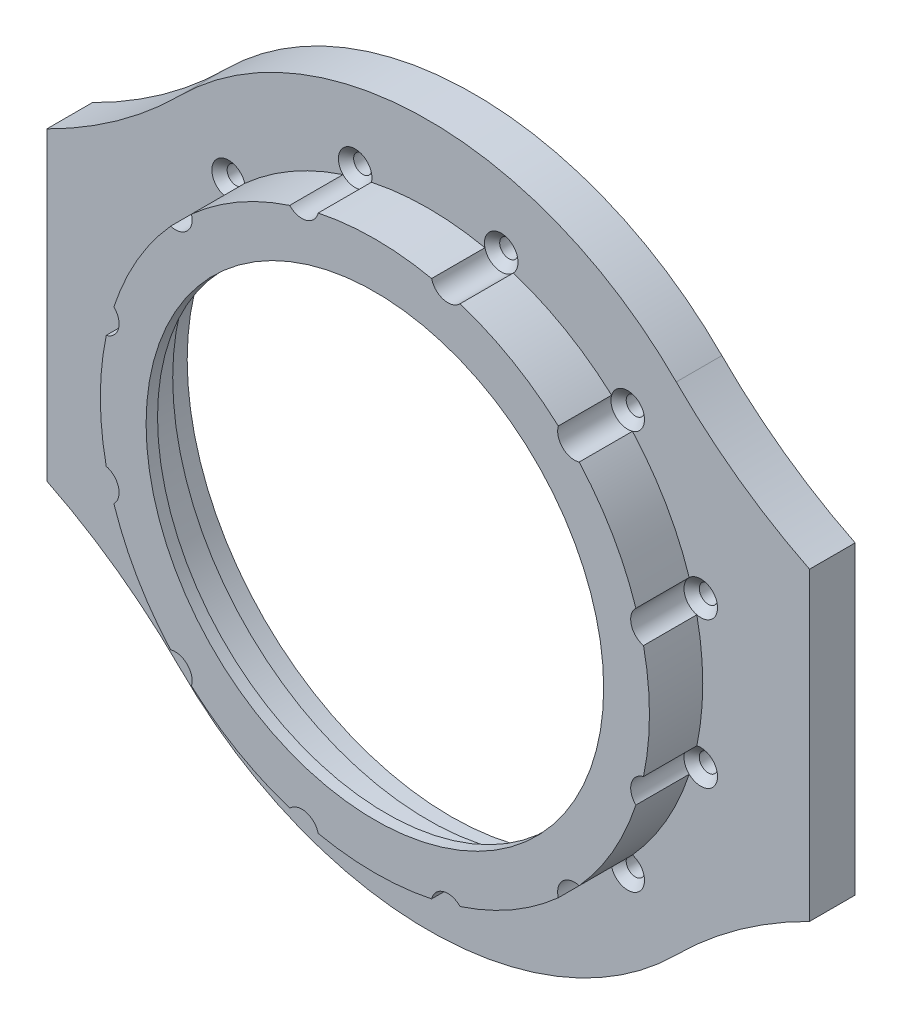
from build123d import *

# Parameters (mm, degrees)
SKETCH_3_R                   = 46
SKETCH_3_R_2                 = 34.6
EXTRUDE_2_DEPTH              = 3
SKETCH_5_R                   = 36
SKETCH_5_R_2                 = 33.5
EXTRUDE_3_DEPTH              = 5.49
EXTRUDE_START                = -2.98
SKETCH_2_R                   = 46
SKETCH_2_R_2                 = 41.6
EXTRUDE_1_DEPTH              = 2.98
SKETCH_6_R                   = 36
SKETCH_6_R_2                 = 30
EXTRUDE_4_DEPTH              = 1.5
EXTRUDE_5_DEPTH              = 3
EXTRUDE_5_DEPTH_BACK         = 2.98
HOLE_WIZARD_M2_1_AT_2_COUNT  = 2
HOLE_WIZARD_M2_1_AT_2_PITCH  = 64.085879878
HOLE_WIZARD_M2_1_AT_3_COUNT  = 2
HOLE_WIZARD_M2_1_AT_3_PITCH  = 71.478511138
HOLE_WIZARD_M2_1_AT_4_COUNT  = 2
HOLE_WIZARD_M2_1_AT_4_PITCH  = 73.999999995
HOLE_WIZARD_M2_1_AT_5_COUNT  = 2
HOLE_WIZARD_M2_1_AT_5_PITCH  = 19.15260934
HOLE_WIZARD_M2_1_AT_6_COUNT  = 2
HOLE_WIZARD_M2_1_AT_6_PITCH  = 36.999999998
HOLE_WIZARD_M2_1_AT_7_COUNT  = 2
HOLE_WIZARD_M2_1_AT_7_PITCH  = 52.325901805
HOLE_WIZARD_M2_1_AT_8_COUNT  = 2
HOLE_WIZARD_M2_1_AT_8_PITCH  = 71.47851114
HOLE_WIZARD_M2_1_AT_9_COUNT  = 2
HOLE_WIZARD_M2_1_AT_9_PITCH  = 64.085879872
HOLE_WIZARD_M2_1_AT_10_COUNT = 2
HOLE_WIZARD_M2_1_AT_10_PITCH = 52.325901805
HOLE_WIZARD_M2_1_AT_11_COUNT = 2
HOLE_WIZARD_M2_1_AT_11_PITCH = 36.999999994
HOLE_WIZARD_M2_1_AT_12_COUNT = 2
HOLE_WIZARD_M2_1_AT_12_PITCH = 19.152609334
CUT_EXTRUDE_1_REACH          = 70.3
SKETCH_13_R                  = 2.2


with BuildPart() as part:
    # 草图3 → 凸台-拉伸2 (new body)
    with BuildSketch(Plane.XY):
        Circle(SKETCH_3_R)
        Circle(SKETCH_3_R_2, mode=Mode.SUBTRACT)
    extrude(amount=EXTRUDE_2_DEPTH)

    # 草图5 → 凸台-拉伸3 (add)
    with BuildSketch(Plane.XY.offset(3)):
        Circle(SKETCH_5_R)
        Circle(SKETCH_5_R_2, mode=Mode.SUBTRACT)
    extrude(amount=EXTRUDE_3_DEPTH)

    # 草图2 → 凸台-拉伸1 (add)
    with BuildSketch(Plane.XY.offset(EXTRUDE_START)):
        Circle(SKETCH_2_R)
        Circle(SKETCH_2_R_2, mode=Mode.SUBTRACT)
    extrude(amount=EXTRUDE_1_DEPTH)

    # 草图6 → 凸台-拉伸4 (add)
    with BuildSketch(Plane.XY.offset(8.49)):
        Circle(SKETCH_6_R)
        Circle(SKETCH_6_R_2, mode=Mode.SUBTRACT)
    extrude(amount=EXTRUDE_4_DEPTH)

    # 草图8 → 凸台-拉伸5 (add, two sides: drawn at the far end of the back side and taken through both)
    with BuildSketch(Plane.XY.offset(-EXTRUDE_5_DEPTH_BACK)):
        with BuildLine():
            Line((-50, -20), (-50, 20))
            ThreePointArc((-50, 20), (-40.750582015, 25.548076808), (-32.526911935, 32.526911935))
            ThreePointArc((-32.526911935, 32.526911935), (-46, 0), (-32.526911935, -32.526911935))
            ThreePointArc((-32.526911935, -32.526911935), (-40.750582015, -25.548076808), (-50, -20))
        make_face()
        with BuildLine():
            Line((50, -20), (50, 20))
            ThreePointArc((50, 20), (40.750582015, 25.548076808), (32.526911935, 32.526911935))
            ThreePointArc((32.526911935, 32.526911935), (46, 0), (32.526911935, -32.526911935))
            ThreePointArc((32.526911935, -32.526911935), (40.750582015, -25.548076808), (50, -20))
        make_face()
    extrude(amount=EXTRUDE_5_DEPTH + EXTRUDE_5_DEPTH_BACK)

    # 草图12 → M2 锥坑平头的锥孔1 (revolve, cut)
    with BuildSketch(Plane(origin=(-35.73925557, -9.57630467, 3), x_dir=(0, -1, 0), z_dir=(1, 0, 0))):
        Polygon((0, 0), (0, 5.98), (1.2, 5.98), (1.2, 1), (2.2, 0), align=None)
    hole_wizard_m2_1 = revolve(axis=Axis((-35.73925557, -9.57630467, 9.35), (0, 0, -1)), mode=Mode.SUBTRACT)

    # M2 锥坑平头的锥孔1 at 2: M2 锥坑平头的锥孔1 ×2
    with Locations(*[Vector(0.7071067811865475, 0.7071067811865476, 0) * (i * HOLE_WIZARD_M2_1_AT_2_PITCH) for i in range(1, HOLE_WIZARD_M2_1_AT_2_COUNT)]):
        add(hole_wizard_m2_1, mode=Mode.SUBTRACT)

    # M2 锥坑平头的锥孔1 at 3: M2 锥坑平头的锥孔1 ×2
    with Locations(*[Vector(0.8660254037776919, 0.500000000011686, 0) * (i * HOLE_WIZARD_M2_1_AT_3_PITCH) for i in range(1, HOLE_WIZARD_M2_1_AT_3_COUNT)]):
        add(hole_wizard_m2_1, mode=Mode.SUBTRACT)

    # M2 锥坑平头的锥孔1 at 4: M2 锥坑平头的锥孔1 ×2
    with Locations(*[Vector(0.9659258262760346, 0.2588190451511635, 0) * (i * HOLE_WIZARD_M2_1_AT_4_PITCH) for i in range(1, HOLE_WIZARD_M2_1_AT_4_COUNT)]):
        add(hole_wizard_m2_1, mode=Mode.SUBTRACT)

    # M2 锥坑平头的锥孔1 at 5: M2 锥坑平头的锥孔1 ×2
    with Locations(*[(0, i * HOLE_WIZARD_M2_1_AT_5_PITCH, 0) for i in range(1, HOLE_WIZARD_M2_1_AT_5_COUNT)]):
        add(hole_wizard_m2_1, mode=Mode.SUBTRACT)

    # M2 锥坑平头的锥孔1 at 6: M2 锥坑平头的锥孔1 ×2
    with Locations(*[Vector(0.25881904515116333, 0.9659258262760346, 0) * (i * HOLE_WIZARD_M2_1_AT_6_PITCH) for i in range(1, HOLE_WIZARD_M2_1_AT_6_COUNT)]):
        add(hole_wizard_m2_1, mode=Mode.SUBTRACT)

    # M2 锥坑平头的锥孔1 at 7: M2 锥坑平头的锥孔1 ×2
    with Locations(*[Vector(0.4999999999563881, 0.866025403809618, 0) * (i * HOLE_WIZARD_M2_1_AT_7_PITCH) for i in range(1, HOLE_WIZARD_M2_1_AT_7_COUNT)]):
        add(hole_wizard_m2_1, mode=Mode.SUBTRACT)

    # M2 锥坑平头的锥孔1 at 8: M2 锥坑平头的锥孔1 ×2
    with Locations(*[(i * HOLE_WIZARD_M2_1_AT_8_PITCH, 0, 0) for i in range(1, HOLE_WIZARD_M2_1_AT_8_COUNT)]):
        add(hole_wizard_m2_1, mode=Mode.SUBTRACT)

    # M2 锥坑平头的锥孔1 at 9: M2 锥坑平头的锥孔1 ×2
    with Locations(*[Vector(0.9659258263021021, -0.2588190450538782, 0) * (i * HOLE_WIZARD_M2_1_AT_9_PITCH) for i in range(1, HOLE_WIZARD_M2_1_AT_9_COUNT)]):
        add(hole_wizard_m2_1, mode=Mode.SUBTRACT)

    # M2 锥坑平头的锥孔1 at 10: M2 锥坑平头的锥孔1 ×2
    with Locations(*[Vector(0.8660254038096179, -0.4999999999563883, 0) * (i * HOLE_WIZARD_M2_1_AT_10_PITCH) for i in range(1, HOLE_WIZARD_M2_1_AT_10_COUNT)]):
        add(hole_wizard_m2_1, mode=Mode.SUBTRACT)

    # M2 锥坑平头的锥孔1 at 11: M2 锥坑平头的锥孔1 ×2
    with Locations(*[Vector(0.7071067811865475, -0.7071067811865477, 0) * (i * HOLE_WIZARD_M2_1_AT_11_PITCH) for i in range(1, HOLE_WIZARD_M2_1_AT_11_COUNT)]):
        add(hole_wizard_m2_1, mode=Mode.SUBTRACT)

    # M2 锥坑平头的锥孔1 at 12: M2 锥坑平头的锥孔1 ×2
    with Locations(*[Vector(0.5000000001627614, -0.8660254036904684, 0) * (i * HOLE_WIZARD_M2_1_AT_12_PITCH) for i in range(1, HOLE_WIZARD_M2_1_AT_12_COUNT)]):
        add(hole_wizard_m2_1, mode=Mode.SUBTRACT)

    # 草图13 → 切除-拉伸1 (cut, up to next)
    with BuildSketch(Plane.XY.offset(3), mode=Mode.PRIVATE) as cut_extrude_1_sk1:
        with Locations((-35.73925557, 9.57630467)):
            Circle(SKETCH_13_R)
    cut_extrude_1_tool1 = extrude(cut_extrude_1_sk1.sketch, amount=CUT_EXTRUDE_1_REACH, mode=Mode.PRIVATE) & part.part
    # 草图13 → 切除-拉伸1 (cut, up to next)
    with BuildSketch(Plane.XY.offset(3), mode=Mode.PRIVATE) as cut_extrude_1_sk2:
        with Locations((-26.1629509, 26.1629509)):
            Circle(SKETCH_13_R)
    cut_extrude_1_tool2 = extrude(cut_extrude_1_sk2.sketch, amount=CUT_EXTRUDE_1_REACH, mode=Mode.PRIVATE) & part.part
    # 草图13 → 切除-拉伸1 (cut, up to next)
    with BuildSketch(Plane.XY.offset(3), mode=Mode.PRIVATE) as cut_extrude_1_sk3:
        with Locations((-9.57630467, 35.73925557)):
            Circle(SKETCH_13_R)
    cut_extrude_1_tool3 = extrude(cut_extrude_1_sk3.sketch, amount=CUT_EXTRUDE_1_REACH, mode=Mode.PRIVATE) & part.part
    # 草图13 → 切除-拉伸1 (cut, up to next)
    with BuildSketch(Plane.XY.offset(3), mode=Mode.PRIVATE) as cut_extrude_1_sk4:
        with Locations((-9.57630467, -35.73925557)):
            Circle(SKETCH_13_R)
    cut_extrude_1_tool4 = extrude(cut_extrude_1_sk4.sketch, amount=CUT_EXTRUDE_1_REACH, mode=Mode.PRIVATE) & part.part
    # 草图13 → 切除-拉伸1 (cut, up to next)
    with BuildSketch(Plane.XY.offset(3), mode=Mode.PRIVATE) as cut_extrude_1_sk5:
        with Locations((-26.1629509, -26.1629509)):
            Circle(SKETCH_13_R)
    cut_extrude_1_tool5 = extrude(cut_extrude_1_sk5.sketch, amount=CUT_EXTRUDE_1_REACH, mode=Mode.PRIVATE) & part.part
    # 草图13 → 切除-拉伸1 (cut, up to next)
    with BuildSketch(Plane.XY.offset(3), mode=Mode.PRIVATE) as cut_extrude_1_sk6:
        with Locations((-35.73925557, -9.57630467)):
            Circle(SKETCH_13_R)
    cut_extrude_1_tool6 = extrude(cut_extrude_1_sk6.sketch, amount=CUT_EXTRUDE_1_REACH, mode=Mode.PRIVATE) & part.part
    # 草图13 → 切除-拉伸1 (cut, up to next)
    with BuildSketch(Plane.XY.offset(3), mode=Mode.PRIVATE) as cut_extrude_1_sk7:
        with Locations((9.57630467, -35.73925557)):
            Circle(SKETCH_13_R)
    cut_extrude_1_tool7 = extrude(cut_extrude_1_sk7.sketch, amount=CUT_EXTRUDE_1_REACH, mode=Mode.PRIVATE) & part.part
    # 草图13 → 切除-拉伸1 (cut, up to next)
    with BuildSketch(Plane.XY.offset(3), mode=Mode.PRIVATE) as cut_extrude_1_sk8:
        with Locations((26.1629509, -26.1629509)):
            Circle(SKETCH_13_R)
    cut_extrude_1_tool8 = extrude(cut_extrude_1_sk8.sketch, amount=CUT_EXTRUDE_1_REACH, mode=Mode.PRIVATE) & part.part
    # 草图13 → 切除-拉伸1 (cut, up to next)
    with BuildSketch(Plane.XY.offset(3), mode=Mode.PRIVATE) as cut_extrude_1_sk9:
        with Locations((9.57630467, 35.73925557)):
            Circle(SKETCH_13_R)
    cut_extrude_1_tool9 = extrude(cut_extrude_1_sk9.sketch, amount=CUT_EXTRUDE_1_REACH, mode=Mode.PRIVATE) & part.part
    # 草图13 → 切除-拉伸1 (cut, up to next)
    with BuildSketch(Plane.XY.offset(3), mode=Mode.PRIVATE) as cut_extrude_1_sk10:
        with Locations((26.1629509, 26.1629509)):
            Circle(SKETCH_13_R)
    cut_extrude_1_tool10 = extrude(cut_extrude_1_sk10.sketch, amount=CUT_EXTRUDE_1_REACH, mode=Mode.PRIVATE) & part.part
    # 草图13 → 切除-拉伸1 (cut, up to next)
    with BuildSketch(Plane.XY.offset(3), mode=Mode.PRIVATE) as cut_extrude_1_sk11:
        with Locations((35.73925557, -9.57630467)):
            Circle(SKETCH_13_R)
    cut_extrude_1_tool11 = extrude(cut_extrude_1_sk11.sketch, amount=CUT_EXTRUDE_1_REACH, mode=Mode.PRIVATE) & part.part
    # 草图13 → 切除-拉伸1 (cut, up to next)
    with BuildSketch(Plane.XY.offset(3), mode=Mode.PRIVATE) as cut_extrude_1_sk12:
        with Locations((35.73925557, 9.57630467)):
            Circle(SKETCH_13_R)
    cut_extrude_1_tool12 = extrude(cut_extrude_1_sk12.sketch, amount=CUT_EXTRUDE_1_REACH, mode=Mode.PRIVATE) & part.part
    add(cut_extrude_1_tool1.solids().sort_by_distance((-35.739256, 9.576305, 3))[0], mode=Mode.SUBTRACT)
    add(cut_extrude_1_tool2.solids().sort_by_distance((-26.162951, 26.162951, 3))[0], mode=Mode.SUBTRACT)
    add(cut_extrude_1_tool3.solids().sort_by_distance((-9.576305, 35.739256, 3))[0], mode=Mode.SUBTRACT)
    add(cut_extrude_1_tool4.solids().sort_by_distance((-9.576305, -35.739256, 3))[0], mode=Mode.SUBTRACT)
    add(cut_extrude_1_tool5.solids().sort_by_distance((-26.162951, -26.162951, 3))[0], mode=Mode.SUBTRACT)
    add(cut_extrude_1_tool6.solids().sort_by_distance((-35.739256, -9.576305, 3))[0], mode=Mode.SUBTRACT)
    add(cut_extrude_1_tool7.solids().sort_by_distance((9.576305, -35.739256, 3))[0], mode=Mode.SUBTRACT)
    add(cut_extrude_1_tool8.solids().sort_by_distance((26.162951, -26.162951, 3))[0], mode=Mode.SUBTRACT)
    add(cut_extrude_1_tool9.solids().sort_by_distance((9.576305, 35.739256, 3))[0], mode=Mode.SUBTRACT)
    add(cut_extrude_1_tool10.solids().sort_by_distance((26.162951, 26.162951, 3))[0], mode=Mode.SUBTRACT)
    add(cut_extrude_1_tool11.solids().sort_by_distance((35.739256, -9.576305, 3))[0], mode=Mode.SUBTRACT)
    add(cut_extrude_1_tool12.solids().sort_by_distance((35.739256, 9.576305, 3))[0], mode=Mode.SUBTRACT)


solid = part.part
